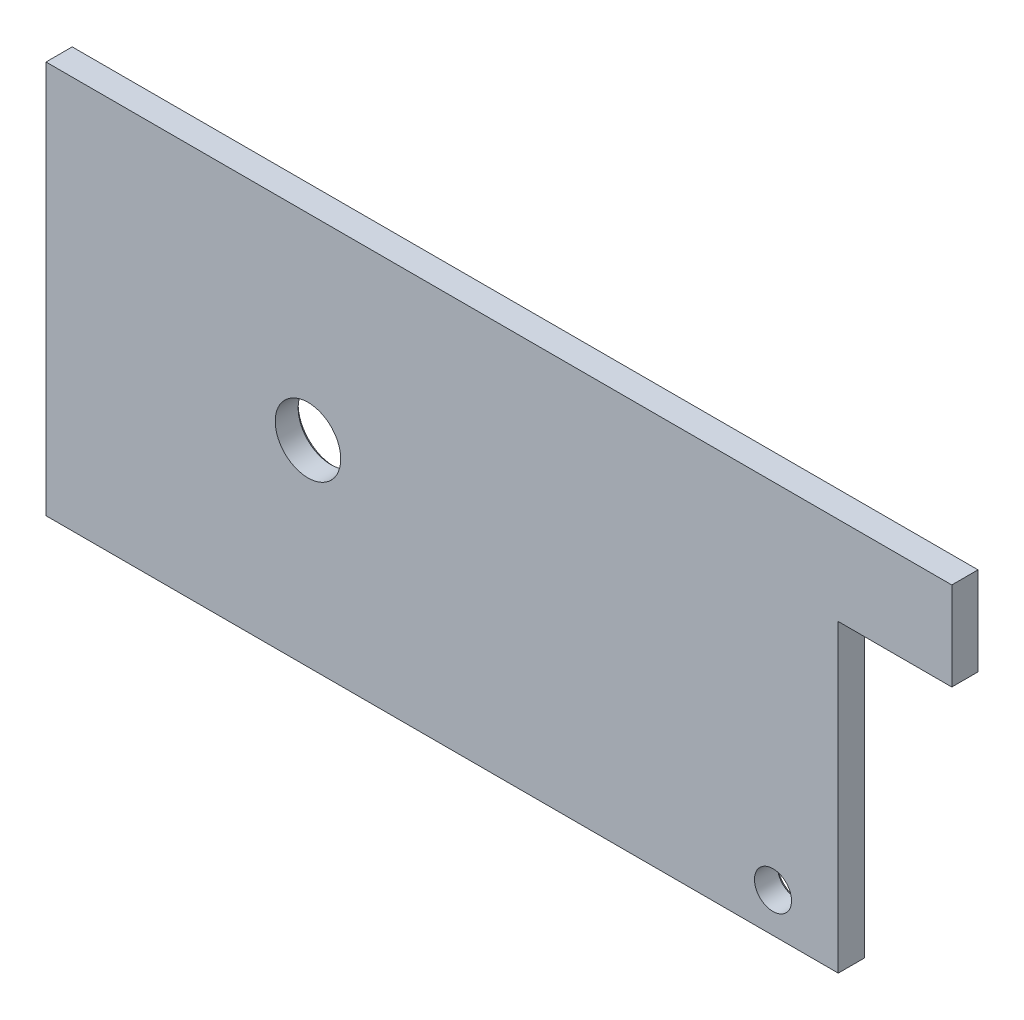
from build123d import *

# Parameters (mm, degrees)
SKETCH1_R           = 5
SKETCH1_R_2         = 2.83
BOSS_EXTRUDE1_DEPTH = 2
CHAMFER1_SIZE       = 0.5


with BuildPart() as part:
    # Sketch1 → Boss-Extrude1 (new, symmetric)
    with BuildSketch(Plane.XY):
        Polygon((-81, -30), (39.961681304, -30), (39.961681304, 16.5), (57.3, 16.5), (57.3, 30), (-81, 30), align=None)
        with Locations((-41, 0)):
            Circle(SKETCH1_R, mode=Mode.SUBTRACT)
        with Locations((30, -24)):
            Circle(SKETCH1_R_2, mode=Mode.SUBTRACT)
    extrude(amount=BOSS_EXTRUDE1_DEPTH, both=True)

    # Chamfer1
    chamfer1_edges = [part.edges().sort_by_distance(p)[0] for p in [
        (27.17, -24, -2),
        (-46, 0, -2),
    ]]
    chamfer(chamfer1_edges, length=CHAMFER1_SIZE)


solid = part.part
